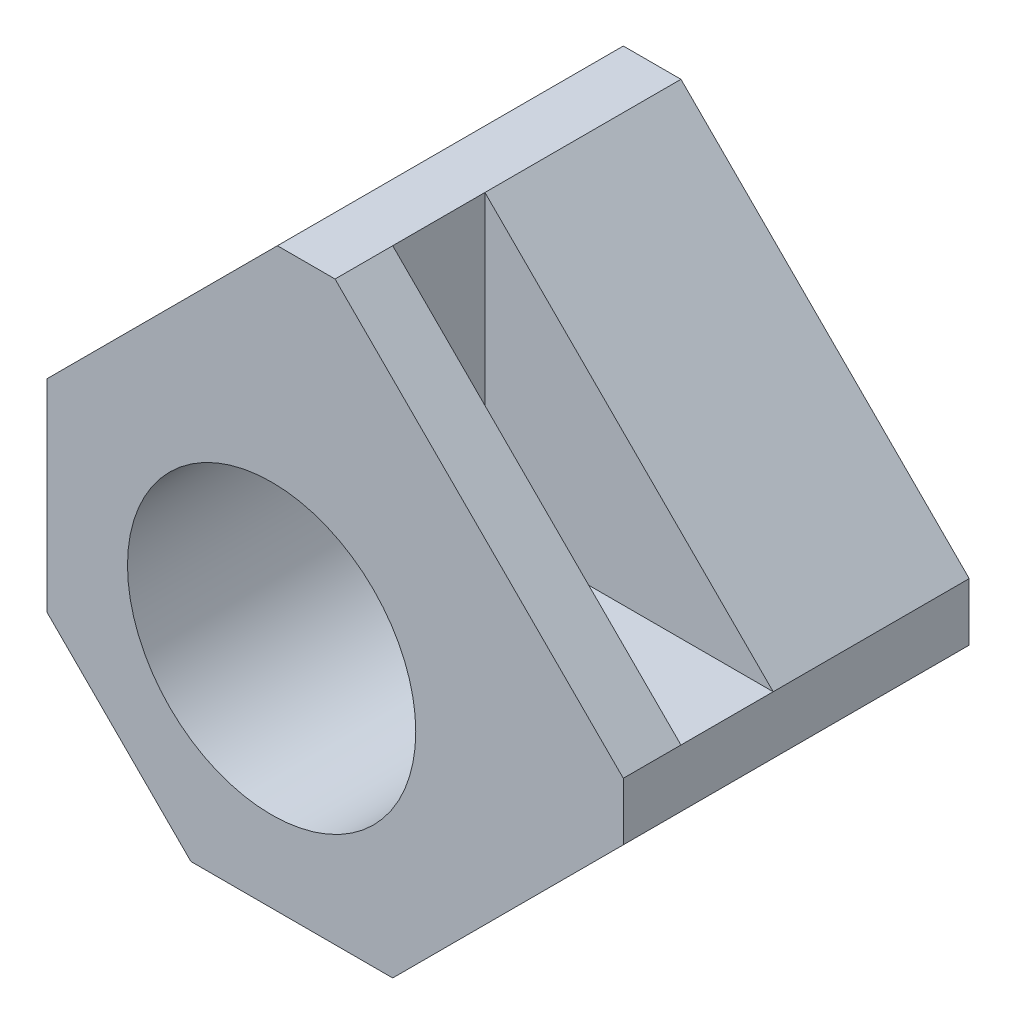
from build123d import *

# Parameters (mm, degrees)
ESQUISSE1_W             = 20
ESQUISSE1_H             = 20
BOSS_EXTRU_1_DEPTH      = 12
CHANFREIN1_SIZE         = 10
ENL_V_START             = -2
ENL_V_MAT_EXTRU_1_DEPTH = 3.2
ESQUISSE3_R             = 2.2
ENL_V_MAT_EXTRU_2_DEPTH = 31.724582991
ESQUISSE4_R             = 5
ENL_V_MAT_EXTRU_3_DEPTH = 10.5
CHANFREIN2_SIZE         = 5
CHANFREIN3_SIZE         = 8


with BuildPart() as part:
    # Esquisse1 → Boss.-Extru.1 (new body)
    with BuildSketch(Plane.XY):
        with Locations((10, 10)):
            Rectangle(ESQUISSE1_W, ESQUISSE1_H)
    extrude(amount=BOSS_EXTRU_1_DEPTH)

    # Chanfrein1
    chanfrein1_edges = [part.edges().sort_by_distance(p)[0] for p in [
        (20, 20, 6),
    ]]
    chamfer(chanfrein1_edges, length=CHANFREIN1_SIZE)

    # Esquisse2 → Enlèv. mat.-Extru.1 (cut)
    with BuildSketch(Plane.XY.offset(12).offset(ENL_V_START)):
        Polygon((10, 20), (10, 10), (20, 10), align=None)
    extrude(amount=-ENL_V_MAT_EXTRU_1_DEPTH, mode=Mode.SUBTRACT)

    # Esquisse3 → Enlèv. mat.-Extru.2 (cut, through all)
    with BuildSketch(Plane(origin=(0, 0, 0), x_dir=(-1, 0, 0), z_dir=(0, 0, -1))):
        with Locations((-7.8, 7.8)):
            Circle(ESQUISSE3_R)
    extrude(amount=-ENL_V_MAT_EXTRU_2_DEPTH, mode=Mode.SUBTRACT)

    # Esquisse4 → Enlèv. mat.-Extru.3 (cut)
    with BuildSketch(Plane.XY.offset(12)):
        with Locations((7.8, 7.8)):
            Circle(ESQUISSE4_R)
    extrude(amount=-ENL_V_MAT_EXTRU_3_DEPTH, mode=Mode.SUBTRACT)

    # Chanfrein2
    chanfrein2_edges = [part.edges().sort_by_distance(p)[0] for p in [
        (0, 0, 6),
    ]]
    chamfer(chanfrein2_edges, length=CHANFREIN2_SIZE)

    # Chanfrein3
    chanfrein3_edges = [part.edges().sort_by_distance(p)[0] for p in [
        (20, 0, 6),
        (0, 20, 6),
    ]]
    chamfer(chanfrein3_edges, length=CHANFREIN3_SIZE)


solid = part.part
